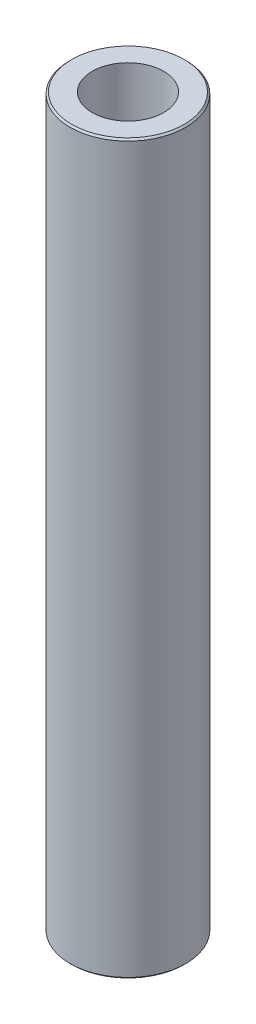
from build123d import *

# Parameters (mm, degrees)
SKETCH1_R           = 7.5
BOSS_EXTRUDE1_DEPTH = 94.203991394
SKETCH2_R           = 4.6318314
CUT_EXTRUDE1_DEPTH  = 95.799219377
CHAMFER1_SIZE       = 0.21725344


with BuildPart() as part:
    # Sketch1 → Boss-Extrude1 (new body)
    with BuildSketch(Plane(origin=(0, 0, 0), x_dir=(1, 0, 0), z_dir=(0, 1, 0))):
        Circle(SKETCH1_R)
    extrude(amount=BOSS_EXTRUDE1_DEPTH)

    # Sketch2 → Cut-Extrude1 (cut, through all)
    with BuildSketch(Plane(origin=(0, 0, 0), x_dir=(1, 0, 0), z_dir=(0, 1, 0))):
        Circle(SKETCH2_R)
    extrude(amount=CUT_EXTRUDE1_DEPTH, mode=Mode.SUBTRACT)

    # Chamfer1
    chamfer1_edges = [part.edges().sort_by_distance(p)[0] for p in [
        (-7.5, 94.203991394, 0),
        (-7.5, 0, 0),
    ]]
    chamfer(chamfer1_edges, length=CHAMFER1_SIZE)


solid = part.part
